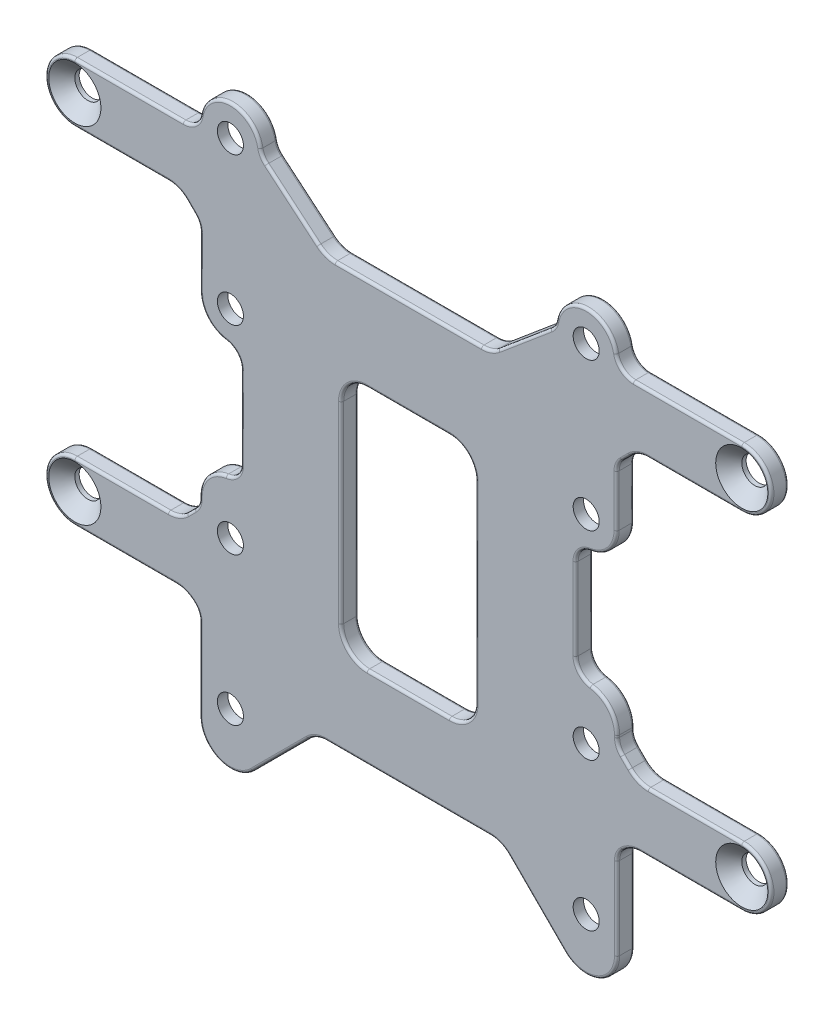
from build123d import *

# Parameters (mm, degrees)
SKETCH_1_R               = 1.5
EXTRUDE_1_DEPTH          = 2
SKETCH_2_R               = 3.5
SKETCH_2_R_2             = 1.5
EXTRUDE_2_DEPTH          = 2
FILLET_1_R               = 2
CUT_EXTRUDE_1_DEPTH      = 105.366282504
CUT_EXTRUDE_1_DEPTH_BACK = 105.366282504
SKETCH_3_R               = 1.5
CUT_EXTRUDE_2_DEPTH      = 105.366282504
CUT_EXTRUDE_2_DEPTH_BACK = 105.366282504
SKETCH_4_W               = 39.369248208
SKETCH_4_H               = 11.656545833
EXTRUDE_START            = -2
SKETCH_6_R               = 1.5
EXTRUDE_3_DEPTH          = 2
CUT_EXTRUDE_3_DEPTH      = 100.215363722
CUT_EXTRUDE_3_DEPTH_BACK = 100.215363722
EXTRUDE_4_DEPTH          = 2
CHAMFER_1_SIZE           = 1.5
CUT_EXTRUDE_4_DEPTH      = 0.8
FILLET_3_R               = 2
FILLET_2_R               = 0.3


with BuildPart() as part:
    # 草图1 → 凸台-拉伸1 (new body)
    with BuildSketch(Plane.XY):
        with BuildLine():
            Line((0, 3.4), (-76.734689568, 3.4))
            ThreePointArc((-76.734689568, 3.4), (-80.134689568, 0), (-76.734689568, -3.4))
            Line((-76.734689568, -3.4), (-65.976825192, -3.4))
            ThreePointArc((-65.976825192, -3.4), (-64.828774895, -3.628361402), (-63.855504848, -4.278679656))
            Line((-63.855504848, -4.278679656), (-58.496024441, -9.638160064))
            ThreePointArc((-58.496024441, -9.638160064), (-57.845706187, -10.611430111), (-57.617344784, -11.759480408))
            Line((-57.617344784, -11.759480408), (-57.617344784, -27.97520916))
            ThreePointArc((-57.617344784, -27.97520916), (-57.845706187, -29.123259457), (-58.496024441, -30.096529504))
            Line((-58.496024441, -30.096529504), (-63.855504848, -35.456009912))
            ThreePointArc((-63.855504848, -35.456009912), (-64.828774895, -36.106328166), (-65.976825192, -36.334689568))
            Line((-65.976825192, -36.334689568), (-76.734689568, -36.334689568))
            ThreePointArc((-76.734689568, -36.334689568), (-80.134689568, -39.734689568), (-76.734689568, -43.134689568))
            Line((-76.734689568, -43.134689568), (-65.098145535, -43.134689568))
            ThreePointArc((-65.098145535, -43.134689568), (-63.950095238, -43.363050971), (-62.976825192, -44.013369225))
            Line((-62.976825192, -44.013369225), (-56.930648545, -50.059545872))
            ThreePointArc((-56.930648545, -50.059545872), (-56.280330291, -51.032815918), (-56.051968888, -52.180866216))
            Line((-56.051968888, -52.180866216), (-56.051968888, -60.591126613))
            ThreePointArc((-56.051968888, -60.591126613), (-55.823607486, -61.73917691), (-55.173289232, -62.712446957))
            Line((-55.173289232, -62.712446957), (-51.930648545, -65.955087644))
            ThreePointArc((-51.930648545, -65.955087644), (-50.957378498, -66.605405898), (-49.809328201, -66.8337673))
            Line((-49.809328201, -66.8337673), (-26.925361367, -66.8337673))
            ThreePointArc((-26.925361367, -66.8337673), (-25.77731107, -66.605405898), (-24.804041024, -65.955087644))
            Line((-24.804041024, -65.955087644), (-21.561400337, -62.712446957))
            ThreePointArc((-21.561400337, -62.712446957), (-20.911082083, -61.73917691), (-20.68272068, -60.591126613))
            Line((-20.68272068, -60.591126613), (-20.68272068, -52.180866216))
            ThreePointArc((-20.68272068, -52.180866216), (-20.454359278, -51.032815918), (-19.804041024, -50.059545872))
            Line((-19.804041024, -50.059545872), (-13.757864376, -44.013369225))
            ThreePointArc((-13.757864376, -44.013369225), (-12.78459433, -43.363050971), (-11.636544033, -43.134689568))
            Line((-11.636544033, -43.134689568), (0, -43.134689568))
            ThreePointArc((0, -43.134689568), (3.4, -39.734689568), (0, -36.334689568))
            Line((0, -36.334689568), (-10.757864376, -36.334689568))
            ThreePointArc((-10.757864376, -36.334689568), (-11.905914673, -36.106328166), (-12.87918472, -35.456009912))
            Line((-12.87918472, -35.456009912), (-18.238665128, -30.096529504))
            ThreePointArc((-18.238665128, -30.096529504), (-18.888983382, -29.123259457), (-19.117344784, -27.97520916))
            Line((-19.117344784, -27.97520916), (-19.117344784, -11.759480408))
            ThreePointArc((-19.117344784, -11.759480408), (-18.888983382, -10.611430111), (-18.238665128, -9.638160064))
            Line((-18.238665128, -9.638160064), (-12.87918472, -4.278679656))
            ThreePointArc((-12.87918472, -4.278679656), (-11.905914673, -3.628361402), (-10.757864376, -3.4))
            Line((-10.757864376, -3.4), (0, -3.4))
            ThreePointArc((0, -3.4), (3.4, 0), (0, 3.4))
        make_face()
        with Locations((-76.734689568, -39.734689568)):
            Circle(SKETCH_1_R, mode=Mode.SUBTRACT)
        with Locations((-76.734689568, 0)):
            Circle(SKETCH_1_R, mode=Mode.SUBTRACT)
        with Locations((0, -39.734689568)):
            Circle(SKETCH_1_R, mode=Mode.SUBTRACT)
        Circle(SKETCH_1_R, mode=Mode.SUBTRACT)
    extrude(amount=EXTRUDE_1_DEPTH)

    # 草图2 → 凸台-拉伸2 (add)
    # profile 1 of 8: a face of its own
    with BuildSketch(Plane.XY.offset(2)):
        with Locations((-58.834689569, 4.45)):
            Circle(SKETCH_2_R)
        with Locations((-58.834689569, 4.45)):
            Circle(SKETCH_2_R_2, mode=Mode.SUBTRACT)
    # profile 2 of 8: a face of its own
    with BuildSketch(Plane.XY.offset(2)):
        with Locations((-17.899999999, 4.45)):
            Circle(SKETCH_2_R)
        with Locations((-17.899999999, 4.45)):
            Circle(SKETCH_2_R_2, mode=Mode.SUBTRACT)
    # profile 3 of 8: a face of its own
    with BuildSketch(Plane.XY.offset(2)):
        with Locations((-17.899999999, -12.55)):
            Circle(SKETCH_2_R)
        with Locations((-17.899999999, -12.55)):
            Circle(SKETCH_2_R_2, mode=Mode.SUBTRACT)
    # profile 4 of 8: a face of its own
    with BuildSketch(Plane.XY.offset(2)):
        with Locations((-58.834689569, -12.55)):
            Circle(SKETCH_2_R)
        with Locations((-58.834689569, -12.55)):
            Circle(SKETCH_2_R_2, mode=Mode.SUBTRACT)
    # profile 5 of 8: a face of its own
    with BuildSketch(Plane.XY.offset(2)):
        with Locations((-58.834689569, -35.414689568)):
            Circle(SKETCH_2_R)
        with Locations((-58.834689569, -35.414689568)):
            Circle(SKETCH_2_R_2, mode=Mode.SUBTRACT)
    # profile 6 of 8: a face of its own
    with BuildSketch(Plane.XY.offset(2)):
        with Locations((-17.899999999, -35.414689568)):
            Circle(SKETCH_2_R)
        with Locations((-17.899999999, -35.414689568)):
            Circle(SKETCH_2_R_2, mode=Mode.SUBTRACT)
    # profile 7 of 8: a face of its own
    with BuildSketch(Plane.XY.offset(2)):
        with Locations((-17.899999999, -52.414689568)):
            Circle(SKETCH_2_R)
        with Locations((-17.899999999, -52.414689568)):
            Circle(SKETCH_2_R_2, mode=Mode.SUBTRACT)
    # profile 8 of 8: a face of its own
    with BuildSketch(Plane.XY.offset(2)):
        with Locations((-58.834689569, -52.414689568)):
            Circle(SKETCH_2_R)
        with Locations((-58.834689569, -52.414689568)):
            Circle(SKETCH_2_R_2, mode=Mode.SUBTRACT)
    extrude(amount=-EXTRUDE_2_DEPTH)

    # 圆角1
    fillet_1_edges = [part.edges().sort_by_distance(p)[0] for p in [
        (-62.173476774, 3.4, 1),
        (-55.495902364, 3.4, 1),
        (-14.561212794, 3.4, 1),
        (-21.238787204, 3.4, 1),
        (-17.658824336, -9.058319273, 1),
        (-19.117344784, -15.831474009, 1),
        (-57.617344784, -15.831474009, 1),
        (-59.075865232, -9.058319273, 1),
        (-18.76870522, -49.024210068, 1),
        (-20.68272068, -54.537533324, 1),
        (-56.051968888, -54.537533324, 1),
        (-57.965984348, -49.024210068, 1),
    ]]
    fillet(fillet_1_edges, radius=FILLET_1_R)

    # 草图3 → 切除-拉伸1 (cut, two sides: drawn at the far end of the back side and taken through both)
    with BuildSketch(Plane.XY.offset(2).offset(-CUT_EXTRUDE_1_DEPTH_BACK)):
        with Locations((-58.834689569, -52.414689568)):
            Circle(SKETCH_3_R)
        with Locations((-17.899999999, -52.414689568)):
            Circle(SKETCH_3_R)
        with Locations((-17.899999999, -35.414689568)):
            Circle(SKETCH_3_R)
        with Locations((-58.834689569, -35.414689568)):
            Circle(SKETCH_3_R)
        with Locations((-58.834689569, -12.55)):
            Circle(SKETCH_3_R)
        with Locations((-17.899999999, -12.55)):
            Circle(SKETCH_3_R)
        with Locations((-17.899999999, 4.45)):
            Circle(SKETCH_3_R)
        with Locations((-58.834689569, 4.45)):
            Circle(SKETCH_3_R)
        with BuildLine():
            Line((-43.099534383, -12.55), (-33.635155185, -12.55))
            ThreePointArc((-33.635155185, -12.55), (-31.513834841, -13.428679656), (-30.635155185, -15.55))
            Line((-30.635155185, -15.55), (-30.635155185, -37.703544582))
            ThreePointArc((-30.635155185, -37.703544582), (-31.513834841, -39.824864925), (-33.635155185, -40.703544582))
            Line((-33.635155185, -40.703544582), (-43.099534383, -40.703544582))
            ThreePointArc((-43.099534383, -40.703544582), (-45.220854727, -39.824864925), (-46.099534383, -37.703544582))
            Line((-46.099534383, -37.703544582), (-46.099534383, -15.55))
            ThreePointArc((-46.099534383, -15.55), (-45.220854727, -13.428679656), (-43.099534383, -12.55))
        make_face()
    extrude(amount=CUT_EXTRUDE_1_DEPTH + CUT_EXTRUDE_1_DEPTH_BACK, mode=Mode.SUBTRACT)

    # 草图4 → 切除-拉伸2 (cut, two sides: drawn at the far end of the back side and taken through both)
    with BuildSketch(Plane.XY.offset(2).offset(-CUT_EXTRUDE_2_DEPTH_BACK)):
        with Locations((-38.367344784, -61.686981987)):
            Rectangle(SKETCH_4_W, SKETCH_4_H)
    extrude(amount=CUT_EXTRUDE_2_DEPTH + CUT_EXTRUDE_2_DEPTH_BACK, mode=Mode.SUBTRACT)

    # 草图6 → 凸台-拉伸3 (add)
    # profile 1 of 4: a face of its own
    with BuildSketch(Plane(origin=(0, 0, 0), x_dir=(-1, 0, 0), z_dir=(0, 0, -1)).offset(EXTRUDE_START)):
        with BuildLine():
            Line((14.349999999, -32.914689568), (14.349999999, -54.914689568))
            ThreePointArc((14.349999999, -54.914689568), (17.899999999, -58.464689568), (21.449999999, -54.914689568))
            Line((21.449999999, -54.914689568), (21.449999999, -32.914689568))
            ThreePointArc((21.449999999, -32.914689568), (17.899999999, -29.364689568), (14.349999999, -32.914689568))
        make_face()
        with Locations(Location((17.899999999, -52.414689568, 0), (0, 0, 180))):
            Circle(SKETCH_6_R, mode=Mode.SUBTRACT)
        with Locations(Location((17.899999999, -35.414689568, 0), (0, 0, 180))):
            Circle(SKETCH_6_R, mode=Mode.SUBTRACT)
    # profile 2 of 4: a face of its own
    with BuildSketch(Plane(origin=(0, 0, 0), x_dir=(-1, 0, 0), z_dir=(0, 0, -1)).offset(EXTRUDE_START)):
        with BuildLine():
            Line((62.384689569, -54.914689568), (62.384689569, -32.914689568))
            ThreePointArc((62.384689569, -32.914689568), (58.834689569, -29.364689568), (55.284689569, -32.914689568))
            Line((55.284689569, -32.914689568), (55.284689569, -54.914689568))
            ThreePointArc((55.284689569, -54.914689568), (58.834689569, -58.464689568), (62.384689569, -54.914689568))
        make_face()
        with Locations(Location((58.834689569, -35.414689568, 0), (0, 0, 180))):
            Circle(SKETCH_6_R, mode=Mode.SUBTRACT)
        with Locations(Location((58.834689569, -52.414689568, 0), (0, 0, 180))):
            Circle(SKETCH_6_R, mode=Mode.SUBTRACT)
    # profile 3 of 4: a face of its own
    with BuildSketch(Plane(origin=(0, 0, 0), x_dir=(-1, 0, 0), z_dir=(0, 0, -1)).offset(EXTRUDE_START)):
        with BuildLine():
            Line((62.334689569, 4.45), (62.334689569, -12.55))
            ThreePointArc((62.334689569, -12.55), (61.479796997, -14.842031128), (59.332742888, -16.014382036))
            Line((59.332742888, -16.014382036), (55.387295656, -16.014382036))
            Line((55.387295656, -16.014382036), (55.387295656, 5.054545455))
            ThreePointArc((55.387295656, 5.054545455), (59.138104552, 7.936823676), (62.334689569, 4.45))
        make_face()
        with Locations(Location((58.834689569, 4.45, 0), (0, 0, 180))):
            Circle(SKETCH_6_R, mode=Mode.SUBTRACT)
        with Locations(Location((58.834689569, -12.55, 0), (0, 0, 180))):
            Circle(SKETCH_6_R, mode=Mode.SUBTRACT)
    # profile 4 of 4: a face of its own
    with BuildSketch(Plane(origin=(0, 0, 0), x_dir=(-1, 0, 0), z_dir=(0, 0, -1)).offset(EXTRUDE_START)):
        with BuildLine():
            Line((21.347393912, 5.054545455), (21.347393912, -16.014382036))
            Line((21.347393912, -16.014382036), (17.40194668, -16.014382036))
            ThreePointArc((17.40194668, -16.014382036), (15.254892571, -14.842031128), (14.399999999, -12.55))
            Line((14.399999999, -12.55), (14.399999999, 4.45))
            ThreePointArc((14.399999999, 4.45), (17.596585016, 7.936823676), (21.347393912, 5.054545455))
        make_face()
        with Locations(Location((17.899999999, -12.55, 0), (0, 0, 180))):
            Circle(SKETCH_6_R, mode=Mode.SUBTRACT)
        with Locations(Location((17.899999999, 4.45, 0), (0, 0, 180))):
            Circle(SKETCH_6_R, mode=Mode.SUBTRACT)
    extrude(amount=EXTRUDE_3_DEPTH)

    # 草图7 → 切除-拉伸3 (cut, two sides: drawn at the far end of the back side and taken through both)
    with BuildSketch(Plane.XY.offset(2).offset(-CUT_EXTRUDE_3_DEPTH_BACK)):
        with BuildLine():
            Line((-54.703647634, 3.86851231), (-48.71025261, -1.16532))
            ThreePointArc((-48.71025261, -1.16532), (-47.80753496, -1.686926399), (-46.780815575, -1.868088464))
            Line((-46.780815575, -1.868088464), (-29.953873993, -1.868088464))
            ThreePointArc((-29.953873993, -1.868088464), (-28.927154608, -1.686926399), (-28.024436958, -1.16532))
            Line((-28.024436958, -1.16532), (-22.031041935, 3.86851231))
            Line((-22.031041935, 3.86851231), (-54.703647634, 3.86851231))
        make_face()
        with BuildLine():
            Line((-20.410229072, -57.424918641), (-26.835546571, -50.999601143))
            ThreePointArc((-26.835546571, -50.999601143), (-27.808816617, -50.349282889), (-28.956866914, -50.120921487))
            Line((-28.956866914, -50.120921487), (-47.777822654, -50.120921487))
            ThreePointArc((-47.777822654, -50.120921487), (-48.925872951, -50.349282889), (-49.899142998, -50.999601143))
            Line((-49.899142998, -50.999601143), (-56.324460496, -57.424918641))
            Line((-56.324460496, -57.424918641), (-20.410229072, -57.424918641))
        make_face()
    extrude(amount=CUT_EXTRUDE_3_DEPTH + CUT_EXTRUDE_3_DEPTH_BACK, mode=Mode.SUBTRACT)

    # 草图8 → 凸台-拉伸4 (add)
    with BuildSketch(Plane.XY.offset(2)):
        Polygon((-54.758250924, -55.85870907), (-56.324460496, -57.424918641), (-56.324460496, -55.85870907), align=None)
        Polygon((-21.976438644, -55.85870907), (-20.410229072, -57.424918641), (-20.410229072, -55.85870907), align=None)
    extrude(amount=-EXTRUDE_4_DEPTH)

    # 倒角1
    chamfer_1_edges = [part.edges().sort_by_distance(p)[0] for p in [
        (-1.5, -39.734689568, 2),
        (-1.5, 0, 2),
        (-78.234689568, -39.734689568, 2),
        (-78.234689568, 0, 2),
    ]]
    chamfer(chamfer_1_edges, length=CHAMFER_1_SIZE)

    # 草图9 → 切除-拉伸4 (cut)
    with BuildSketch(Plane(origin=(0, 0, 0), x_dir=(-1, 0, 0), z_dir=(0, 0, -1))):
        with BuildLine():
            Line((19.227905618, 7.25), (16.57209438, 7.25))
            ThreePointArc((16.57209438, 7.25), (16.32209438, 7.183012702), (16.139081678, 7))
            Line((16.139081678, 7), (14.811176059, 4.7))
            ThreePointArc((14.811176059, 4.7), (14.744188761, 4.45), (14.811176059, 4.2))
            Line((14.811176059, 4.2), (16.139081678, 1.9))
            ThreePointArc((16.139081678, 1.9), (16.32209438, 1.716987298), (16.57209438, 1.65))
            Line((16.57209438, 1.65), (19.227905618, 1.65))
            ThreePointArc((19.227905618, 1.65), (19.477905618, 1.716987298), (19.66091832, 1.9))
            Line((19.66091832, 1.9), (20.988823939, 4.2))
            ThreePointArc((20.988823939, 4.2), (21.055811237, 4.45), (20.988823939, 4.7))
            Line((20.988823939, 4.7), (19.66091832, 7))
            ThreePointArc((19.66091832, 7), (19.477905618, 7.183012702), (19.227905618, 7.25))
        make_face()
        with BuildLine():
            Line((57.50678395, 1.65), (60.162595188, 1.65))
            ThreePointArc((60.162595188, 1.65), (60.412595188, 1.716987298), (60.59560789, 1.9))
            Line((60.59560789, 1.9), (61.923513509, 4.2))
            ThreePointArc((61.923513509, 4.2), (61.990500807, 4.45), (61.923513509, 4.7))
            Line((61.923513509, 4.7), (60.59560789, 7))
            ThreePointArc((60.59560789, 7), (60.412595188, 7.183012702), (60.162595188, 7.25))
            Line((60.162595188, 7.25), (57.50678395, 7.25))
            ThreePointArc((57.50678395, 7.25), (57.25678395, 7.183012702), (57.073771248, 7))
            Line((57.073771248, 7), (55.745865629, 4.7))
            ThreePointArc((55.745865629, 4.7), (55.678878331, 4.45), (55.745865629, 4.2))
            Line((55.745865629, 4.2), (57.073771248, 1.9))
            ThreePointArc((57.073771248, 1.9), (57.25678395, 1.716987298), (57.50678395, 1.65))
        make_face()
        with BuildLine():
            Line((19.66091832, -15.1), (20.988823939, -12.8))
            ThreePointArc((20.988823939, -12.8), (21.055811237, -12.55), (20.988823939, -12.3))
            Line((20.988823939, -12.3), (19.66091832, -10))
            ThreePointArc((19.66091832, -10), (19.477905618, -9.816987298), (19.227905618, -9.75))
            Line((19.227905618, -9.75), (16.57209438, -9.75))
            ThreePointArc((16.57209438, -9.75), (16.32209438, -9.816987298), (16.139081678, -10))
            Line((16.139081678, -10), (14.811176059, -12.3))
            ThreePointArc((14.811176059, -12.3), (14.744188761, -12.55), (14.811176059, -12.8))
            Line((14.811176059, -12.8), (16.139081678, -15.1))
            ThreePointArc((16.139081678, -15.1), (16.32209438, -15.283012702), (16.57209438, -15.35))
            Line((16.57209438, -15.35), (19.227905618, -15.35))
            ThreePointArc((19.227905618, -15.35), (19.477905618, -15.283012702), (19.66091832, -15.1))
        make_face()
        with BuildLine():
            Line((60.59560789, -15.1), (61.923513509, -12.8))
            ThreePointArc((61.923513509, -12.8), (61.990500807, -12.55), (61.923513509, -12.3))
            Line((61.923513509, -12.3), (60.59560789, -10))
            ThreePointArc((60.59560789, -10), (60.412595188, -9.816987298), (60.162595188, -9.75))
            Line((60.162595188, -9.75), (57.50678395, -9.75))
            ThreePointArc((57.50678395, -9.75), (57.25678395, -9.816987298), (57.073771248, -10))
            Line((57.073771248, -10), (55.745865629, -12.3))
            ThreePointArc((55.745865629, -12.3), (55.678878331, -12.55), (55.745865629, -12.8))
            Line((55.745865629, -12.8), (57.073771248, -15.1))
            ThreePointArc((57.073771248, -15.1), (57.25678395, -15.283012702), (57.50678395, -15.35))
            Line((57.50678395, -15.35), (60.162595188, -15.35))
            ThreePointArc((60.162595188, -15.35), (60.412595188, -15.283012702), (60.59560789, -15.1))
        make_face()
        with BuildLine():
            Line((16.57209438, -38.214689568), (19.227905618, -38.214689568))
            ThreePointArc((19.227905618, -38.214689568), (19.477905618, -38.14770227), (19.66091832, -37.964689568))
            Line((19.66091832, -37.964689568), (20.988823939, -35.664689568))
            ThreePointArc((20.988823939, -35.664689568), (21.055811237, -35.414689568), (20.988823939, -35.164689568))
            Line((20.988823939, -35.164689568), (19.66091832, -32.864689568))
            ThreePointArc((19.66091832, -32.864689568), (19.477905618, -32.681676866), (19.227905618, -32.614689568))
            Line((19.227905618, -32.614689568), (16.57209438, -32.614689568))
            ThreePointArc((16.57209438, -32.614689568), (16.32209438, -32.681676866), (16.139081678, -32.864689568))
            Line((16.139081678, -32.864689568), (14.811176059, -35.164689568))
            ThreePointArc((14.811176059, -35.164689568), (14.744188761, -35.414689568), (14.811176059, -35.664689568))
            Line((14.811176059, -35.664689568), (16.139081678, -37.964689568))
            ThreePointArc((16.139081678, -37.964689568), (16.32209438, -38.14770227), (16.57209438, -38.214689568))
        make_face()
        with BuildLine():
            Line((19.227905618, -49.614689568), (16.57209438, -49.614689568))
            ThreePointArc((16.57209438, -49.614689568), (16.32209438, -49.681676866), (16.139081678, -49.864689568))
            Line((16.139081678, -49.864689568), (14.811176059, -52.164689568))
            ThreePointArc((14.811176059, -52.164689568), (14.744188761, -52.414689568), (14.811176059, -52.664689568))
            Line((14.811176059, -52.664689568), (16.139081678, -54.964689568))
            ThreePointArc((16.139081678, -54.964689568), (16.32209438, -55.14770227), (16.57209438, -55.214689568))
            Line((16.57209438, -55.214689568), (19.227905618, -55.214689568))
            ThreePointArc((19.227905618, -55.214689568), (19.477905618, -55.14770227), (19.66091832, -54.964689568))
            Line((19.66091832, -54.964689568), (20.988823939, -52.664689568))
            ThreePointArc((20.988823939, -52.664689568), (21.055811237, -52.414689568), (20.988823939, -52.164689568))
            Line((20.988823939, -52.164689568), (19.66091832, -49.864689568))
            ThreePointArc((19.66091832, -49.864689568), (19.477905618, -49.681676866), (19.227905618, -49.614689568))
        make_face()
        with BuildLine():
            Line((60.162595188, -32.614689568), (57.50678395, -32.614689568))
            ThreePointArc((57.50678395, -32.614689568), (57.25678395, -32.681676866), (57.073771248, -32.864689568))
            Line((57.073771248, -32.864689568), (55.745865629, -35.164689568))
            ThreePointArc((55.745865629, -35.164689568), (55.678878331, -35.414689568), (55.745865629, -35.664689568))
            Line((55.745865629, -35.664689568), (57.073771248, -37.964689568))
            ThreePointArc((57.073771248, -37.964689568), (57.25678395, -38.14770227), (57.50678395, -38.214689568))
            Line((57.50678395, -38.214689568), (60.162595188, -38.214689568))
            ThreePointArc((60.162595188, -38.214689568), (60.412595188, -38.14770227), (60.59560789, -37.964689568))
            Line((60.59560789, -37.964689568), (61.923513509, -35.664689568))
            ThreePointArc((61.923513509, -35.664689568), (61.990500807, -35.414689568), (61.923513509, -35.164689568))
            Line((61.923513509, -35.164689568), (60.59560789, -32.864689568))
            ThreePointArc((60.59560789, -32.864689568), (60.412595188, -32.681676866), (60.162595188, -32.614689568))
        make_face()
        with BuildLine():
            Line((60.162595188, -49.614689568), (57.50678395, -49.614689568))
            ThreePointArc((57.50678395, -49.614689568), (57.25678395, -49.681676866), (57.073771248, -49.864689568))
            Line((57.073771248, -49.864689568), (55.745865629, -52.164689568))
            ThreePointArc((55.745865629, -52.164689568), (55.678878331, -52.414689568), (55.745865629, -52.664689568))
            Line((55.745865629, -52.664689568), (57.073771248, -54.964689568))
            ThreePointArc((57.073771248, -54.964689568), (57.25678395, -55.14770227), (57.50678395, -55.214689568))
            Line((57.50678395, -55.214689568), (60.162595188, -55.214689568))
            ThreePointArc((60.162595188, -55.214689568), (60.412595188, -55.14770227), (60.59560789, -54.964689568))
            Line((60.59560789, -54.964689568), (61.923513509, -52.664689568))
            ThreePointArc((61.923513509, -52.664689568), (61.990500807, -52.414689568), (61.923513509, -52.164689568))
            Line((61.923513509, -52.164689568), (60.59560789, -49.864689568))
            ThreePointArc((60.59560789, -49.864689568), (60.412595188, -49.681676866), (60.162595188, -49.614689568))
        make_face()
    extrude(amount=-CUT_EXTRUDE_4_DEPTH, mode=Mode.SUBTRACT)

    # 圆角3
    fillet_3_edges = [part.edges().sort_by_distance(p)[0] for p in [
        (-62.334689569, -5.799494936, 1),
        (-14.399999999, -5.799494936, 1),
        (-18.723300904, -29.461477206, 1),
        (-14.349999999, -33.985194632, 1),
        (-14.349999999, -44.605504847, 1),
        (-62.384689569, -44.605504847, 1),
        (-62.384689569, -33.985194632, 1),
        (-58.011388664, -29.461477206, 1),
    ]]
    fillet(fillet_3_edges, radius=FILLET_3_R)

    # 圆角2
    fillet_2_edges = [part.edges().sort_by_distance(p)[0] for p in [
        (-63.387990428, -4.746194077, 2),
        (-62.486930504, -5.862555196, 2),
        (-64.828774895, -3.628361402, 2),
        (-62.334689569, -9.58896103, 2),
        (-71.35575738, -3.4, 2),
        (-61.479796997, -14.842031128, 2),
        (-80.134689568, 0, 2),
        (-58.105854825, -16.684296841, 2),
        (-70.493356215, 3.4, 2),
        (-57.617344784, -22.707090105, 2),
        (-62.965731505, 3.86851231, 2),
        (-58.106703227, -28.730861824, 2),
        (-58.834689569, 7.95, 2),
        (-61.516078334, -30.588178383, 2),
        (-55.150107934, 4.401214891, 2),
        (-62.384689569, -33.035728538, 2),
        (-51.706950122, 1.351596155, 2),
        (-62.536930504, -33.922134372, 2),
        (-47.80753496, -1.686926399, 2),
        (-63.412990428, -35.013495491, 2),
        (-38.367344784, -1.868088464, 2),
        (-64.828774895, -36.106328166, 2),
        (-28.927154608, -1.686926399, 2),
        (-71.35575738, -36.334689568, 2),
        (-25.027739446, 1.351596155, 2),
        (-80.134689568, -39.734689568, 2),
        (-21.584581634, 4.401214891, 2),
        (-70.916417552, -43.134689568, 2),
        (-17.899999999, 7.95, 2),
        (-63.950095238, -43.363050971, 2),
        (-13.768958064, 3.86851231, 2),
        (-62.973650599, -44.016543817, 2),
        (-6.241333353, 3.4, 2),
        (-62.536930504, -44.668565107, 2),
        (3.4, 0, 2),
        (-62.384689569, -50.17431077, 2),
        (-5.378932188, -3.4, 2),
        (-60.193215754, -58.194461909, 2),
        (-11.905914673, -3.628361402, 2),
        (-53.111801747, -54.212259892, 2),
        (-13.346699141, -4.746194077, 2),
        (-48.925872951, -50.349282889, 2),
        (-14.247759064, -5.862555196, 2),
        (-38.367344784, -50.120921487, 2),
        (-14.399999999, -9.58896103, 2),
        (-27.808816617, -50.349282889, 2),
        (-15.254892571, -14.842031128, 2),
        (-23.622887821, -54.212259892, 2),
        (-18.628834743, -16.684296841, 2),
        (-16.541473814, -58.194461909, 2),
        (-19.117344784, -22.707090105, 2),
        (-14.349999999, -50.17431077, 2),
        (-18.627986342, -28.730861824, 2),
        (-14.197759064, -44.668565107, 2),
        (-15.218611234, -30.588178383, 2),
        (-13.761038969, -44.016543817, 2),
        (-14.349999999, -33.035728538, 2),
        (-12.78459433, -43.363050971, 2),
        (-14.197759064, -33.922134372, 2),
        (-5.818272016, -43.134689568, 2),
        (-13.321699141, -35.013495491, 2),
        (3.4, -39.734689568, 2),
        (-11.905914673, -36.106328166, 2),
        (-5.378932188, -36.334689568, 2),
        (-31.513834841, -39.824864925, 2),
        (-38.367344784, -40.703544582, 2),
        (-45.220854727, -39.824864925, 2),
        (-46.099534383, -26.626772291, 2),
        (-45.220854727, -13.428679656, 2),
        (-38.367344784, -12.55, 2),
        (-31.513834841, -13.428679656, 2),
        (-30.635155185, -26.626772291, 2),
        (-63.387990428, -4.746194077, 0),
        (-62.486930504, -5.862555196, 0),
        (-64.828774895, -3.628361402, 0),
        (-62.334689569, -9.58896103, 0),
        (-71.35575738, -3.4, 0),
        (-61.479796997, -14.842031128, 0),
        (-80.134689568, 0, 0),
        (-58.105854825, -16.684296841, 0),
        (-70.493356215, 3.4, 0),
        (-57.617344784, -22.707090105, 0),
        (-62.965731505, 3.86851231, 0),
        (-58.106703227, -28.730861824, 0),
        (-58.834689569, 7.95, 0),
        (-61.516078334, -30.588178383, 0),
        (-55.150107934, 4.401214891, 0),
        (-62.384689569, -33.035728538, 0),
        (-51.706950122, 1.351596155, 0),
        (-62.536930504, -33.922134372, 0),
        (-47.80753496, -1.686926399, 0),
        (-63.412990428, -35.013495491, 0),
        (-38.367344784, -1.868088464, 0),
        (-64.828774895, -36.106328166, 0),
        (-28.927154608, -1.686926399, 0),
        (-71.35575738, -36.334689568, 0),
        (-25.027739446, 1.351596155, 0),
        (-80.134689568, -39.734689568, 0),
        (-21.584581634, 4.401214891, 0),
        (-70.916417552, -43.134689568, 0),
        (-17.899999999, 7.95, 0),
        (-63.950095238, -43.363050971, 0),
        (-13.768958064, 3.86851231, 0),
        (-62.973650599, -44.016543817, 0),
        (-6.241333353, 3.4, 0),
        (-62.536930504, -44.668565107, 0),
        (3.4, 0, 0),
        (-62.384689569, -50.17431077, 0),
        (-5.378932188, -3.4, 0),
        (-60.193215754, -58.194461909, 0),
        (-11.905914673, -3.628361402, 0),
        (-53.111801747, -54.212259892, 0),
        (-13.346699141, -4.746194077, 0),
        (-48.925872951, -50.349282889, 0),
        (-14.247759064, -5.862555196, 0),
        (-38.367344784, -50.120921487, 0),
        (-14.399999999, -9.58896103, 0),
        (-27.808816617, -50.349282889, 0),
        (-15.254892571, -14.842031128, 0),
        (-23.622887821, -54.212259892, 0),
        (-18.628834743, -16.684296841, 0),
        (-16.541473814, -58.194461909, 0),
        (-19.117344784, -22.707090105, 0),
        (-14.349999999, -50.17431077, 0),
        (-18.627986342, -28.730861824, 0),
        (-14.197759064, -44.668565107, 0),
        (-15.218611234, -30.588178383, 0),
        (-13.761038969, -44.016543817, 0),
        (-14.349999999, -33.035728538, 0),
        (-12.78459433, -43.363050971, 0),
        (-14.197759064, -33.922134372, 0),
        (-5.818272016, -43.134689568, 0),
        (-13.321699141, -35.013495491, 0),
        (3.4, -39.734689568, 0),
        (-11.905914673, -36.106328166, 0),
        (-5.378932188, -36.334689568, 0),
        (-31.513834841, -39.824864925, 0),
        (-38.367344784, -40.703544582, 0),
        (-45.220854727, -39.824864925, 0),
        (-46.099534383, -26.626772291, 0),
        (-45.220854727, -13.428679656, 0),
        (-38.367344784, -12.55, 0),
        (-31.513834841, -13.428679656, 0),
        (-30.635155185, -26.626772291, 0),
    ]]
    fillet(fillet_2_edges, radius=FILLET_2_R)


solid = part.part
